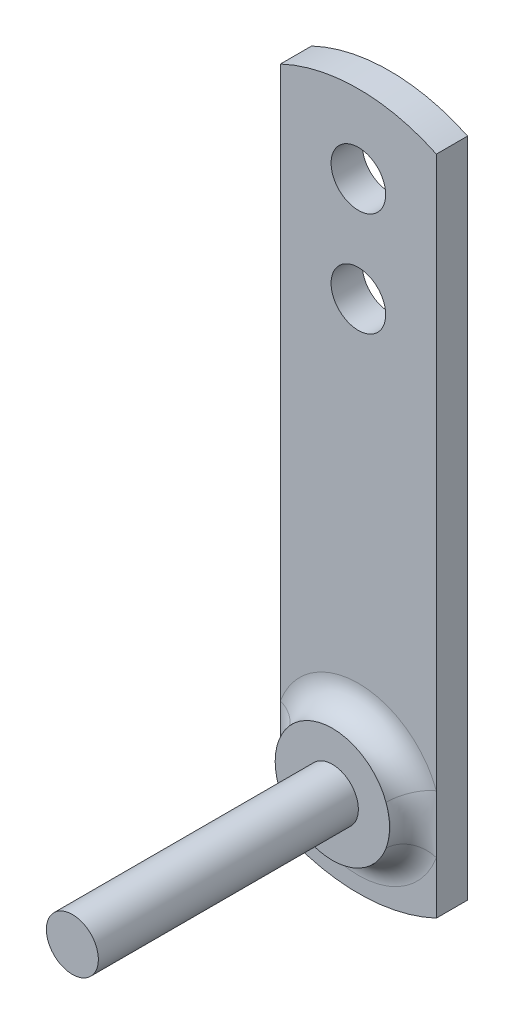
from build123d import *

# Parameters (mm, degrees)
SKICA1_R                 = 5.25
P_IDAT_VYSUNUT_M1_DEPTH  = 6
SKICA2_R                 = 11
P_IDAT_VYSUNUT_M2_DEPTH  = 5
SKICA3_W                 = 36.875028654
SKICA3_H                 = 156.768575318
SKICA3_W_2               = 39.825030946
SKICA3_H_2               = 162.668579902
ODEBRAT_VYSUNUT_M1_DEPTH = 10
ZAOBLIT1_R               = 5
SKICA4_R                 = 5
P_IDAT_VYSUNUT_M3_DEPTH  = 50


with BuildPart() as part:
    # Skica1 → Přidat vysunutím1 (new body)
    with BuildSketch(Plane.XY):
        with BuildLine():
            Line((-17.5, -62.310889132), (-17.5, 62.310889132))
            ThreePointArc((-17.5, 62.310889132), (0, 67), (17.5, 62.310889132))
            Line((17.5, 62.310889132), (17.5, -62.310889132))
            ThreePointArc((17.5, -62.310889132), (0, -67), (-17.5, -62.310889132))
        make_face()
        with Locations((0, 52)):
            Circle(SKICA1_R, mode=Mode.SUBTRACT)
        with Locations((0, 32)):
            Circle(SKICA1_R, mode=Mode.SUBTRACT)
    extrude(amount=P_IDAT_VYSUNUT_M1_DEPTH)

    # Skica2 → Přidat vysunutím2 (add)
    with BuildSketch(Plane.XY.offset(6)):
        with Locations((0, -48)):
            Circle(SKICA2_R)
    extrude(amount=P_IDAT_VYSUNUT_M2_DEPTH)

    # Skica3 → Odebrat vysunutím1 (cut)
    with BuildSketch(Plane.XY.offset(6)):
        with Locations((33.437514327, 0)):
            Rectangle(SKICA3_W, SKICA3_H)
        with Locations((-34.912515473, 0)):
            Rectangle(SKICA3_W_2, SKICA3_H_2)
    extrude(amount=-ODEBRAT_VYSUNUT_M1_DEPTH, mode=Mode.SUBTRACT)

    # Zaoblit1
    zaoblit1_edges = [part.edges().sort_by_distance(p)[0] for p in [
        (-11, -48, 6),
    ]]
    fillet(zaoblit1_edges, radius=ZAOBLIT1_R - 0.0001)  # a hair under: the kernel refuses the full size

    # Skica4 → Přidat vysunutím3 (add)
    with BuildSketch(Plane.XY.offset(11)):
        with Locations((0, -48)):
            Circle(SKICA4_R)
    extrude(amount=P_IDAT_VYSUNUT_M3_DEPTH)


solid = part.part
